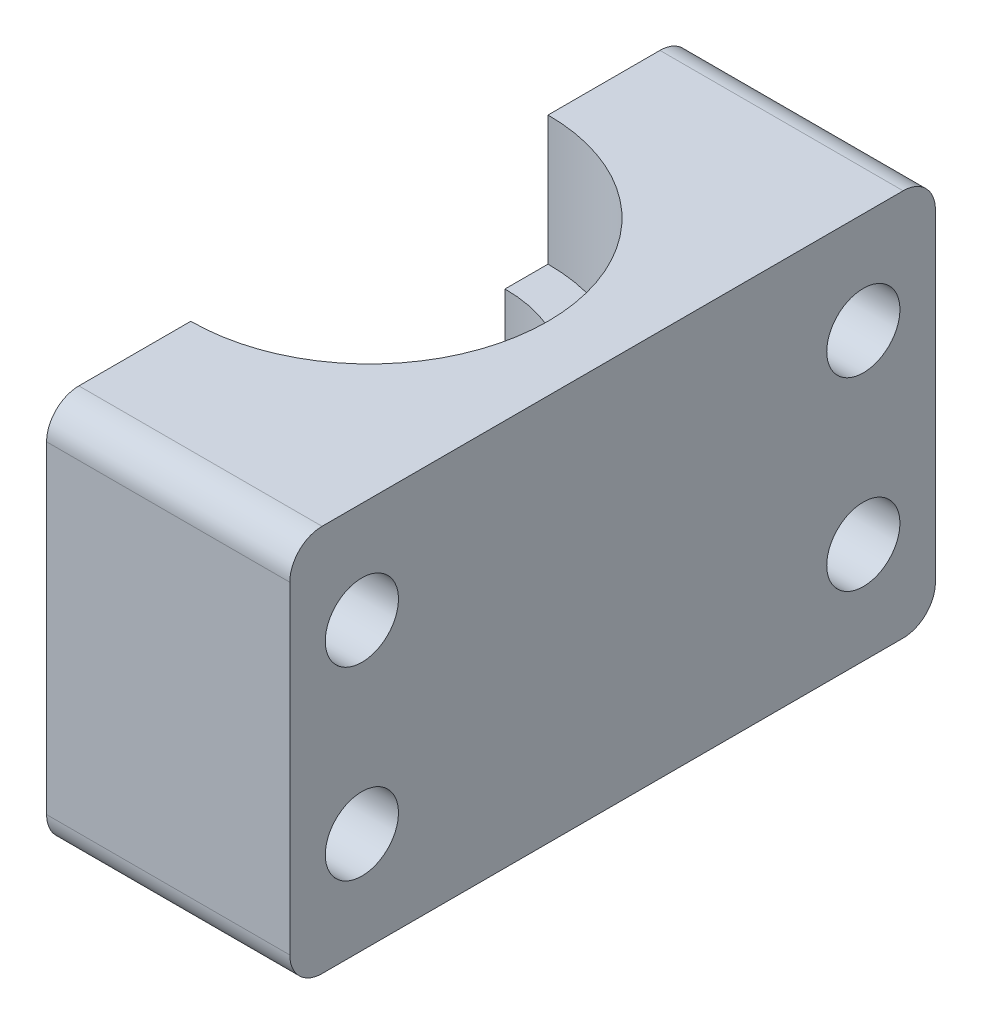
from build123d import *

# Parameters (mm, degrees)
SKETCH8_W           = 30
SKETCH8_H           = 100
BOSS_EXTRUDE1_DEPTH = 100
SKETCH9_W           = 88.7
SKETCH9_H           = 30
CUT_EXTRUDE1_DEPTH  = 103.708324882
SKETCH10_R          = 1.7
CUT_EXTRUDE2_DEPTH  = 21.825225089
FILLET1_R           = 1.5


with BuildPart() as part:
    # Sketch8 → Boss-Extrude1 (new body)
    with BuildSketch(Plane(origin=(0, 0, 0), x_dir=(0, 0, -1), z_dir=(1, 0, 0))):
        Rectangle(SKETCH8_W, SKETCH8_H)
    extrude(amount=BOSS_EXTRUDE1_DEPTH)

    # Sketch7 → Cut-Revolve3 (revolve, cut)
    with BuildSketch(Plane(origin=(0, 0, 0), x_dir=(0, 0, -1), z_dir=(1, 0, 0))):
        Polygon((-8.3, 9), (-150, 9), (-150, 50), (0, 50), (0, -50), (-150, -50), (-150, -9), (-8.3, -9), (-8.3, -3), (-6.3, -3), (-6.3, 3), (-8.3, 3), align=None)
    revolve(axis=Axis((0, -50, 0), (0, 1, 0)), mode=Mode.SUBTRACT)

    # Sketch9 → Cut-Extrude1 (cut, through all)
    with BuildSketch(Plane(origin=(0, 9, 0), x_dir=(1, 0, 0), z_dir=(0, 1, 0))):
        with Locations((55.65, 0)):
            Rectangle(SKETCH9_W, SKETCH9_H)
    extrude(amount=-CUT_EXTRUDE1_DEPTH, mode=Mode.SUBTRACT)

    # Sketch10 → Cut-Extrude2 (cut, through all)
    with BuildSketch(Plane.ZY):
        with Locations((-11.65, 4.3)):
            Circle(SKETCH10_R)
        with Locations((-11.65, -4.3)):
            Circle(SKETCH10_R)
        with Locations((11.65, -4.3)):
            Circle(SKETCH10_R)
        with Locations((11.65, 4.3)):
            Circle(SKETCH10_R)
    extrude(amount=-CUT_EXTRUDE2_DEPTH, mode=Mode.SUBTRACT)

    # Fillet1
    fillet1_edges = [part.edges().sort_by_distance(p)[0] for p in [
        (5.65, 9, -15),
        (5.65, -9, -15),
        (5.65, -9, 15),
        (5.65, 9, 15),
    ]]
    fillet(fillet1_edges, radius=FILLET1_R)


solid = part.part
